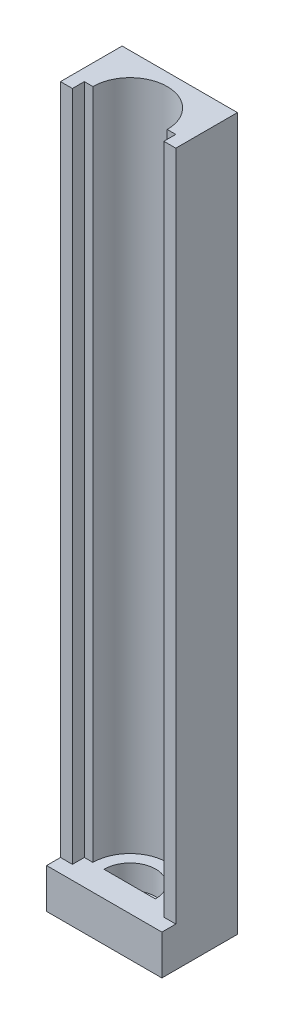
from build123d import *

# Parameters (mm, degrees)
MOLD_BLOCK_WITH_RIDGES_DEPTH  = 169
SKETCH2_W                     = 29
SKETCH2_H                     = 19
BOTTOM_LEDGE_DEPTH            = 10
ROD_ALIGNMENT_HOLE_DEPTH      = 2
ROD_ALIGNMENT_HOLE_DEPTH_BACK = 6
SUBTRACT_ACTUATOR_DEPTH       = 169


# Read off the part's stored shape, not the designer's step: subtract actuator
with BuildPart() as part:
    # Sketch1 → mold block with ridges (new body)
    with BuildSketch(Plane(origin=(0, 0, 0), x_dir=(1, 0, 0), z_dir=(0, 1, 0))):
        Polygon((3, 0), (26, 0), (26, -3), (29, -3), (29, 2.5), (29, 12.5), (0, 12.5), (0, 0), (0, -3), (3, -3), align=None)
    extrude(amount=MOLD_BLOCK_WITH_RIDGES_DEPTH)

    # Sketch2 → bottom ledge (add)
    with BuildSketch(Plane.XZ):
        with Locations((14.5, -3)):
            Rectangle(SKETCH2_W, SKETCH2_H)
    extrude(amount=BOTTOM_LEDGE_DEPTH)

    # Sketch3 → rod alignment hole (cut, two sides: drawn at the far end of the back side and taken through both)
    with BuildSketch(Plane(origin=(0, 0, 0), x_dir=(1, 0, 0), z_dir=(0, 1, 0)).offset(-ROD_ALIGNMENT_HOLE_DEPTH_BACK)):
        with BuildLine():
            Line((8.05077524, -0.1), (20.94922476, -0.1))
            ThreePointArc((20.94922476, -0.1), (14.5, 6.45), (8.05077524, -0.1))
        make_face()
    extrude(amount=ROD_ALIGNMENT_HOLE_DEPTH + ROD_ALIGNMENT_HOLE_DEPTH_BACK, mode=Mode.SUBTRACT)

    # subtract actuator outline → subtract actuator (cut)
    with BuildSketch(Plane(origin=(0, 0, 0), x_dir=(1, 0, 0), z_dir=(0, 1, 0))):
        with BuildLine():
            ThreePointArc((23.85, 0), (14.5, 9.35), (5.15, 0))
            Line((5.15, 0), (23.85, 0))
        make_face()
    extrude(amount=SUBTRACT_ACTUATOR_DEPTH, mode=Mode.SUBTRACT)


solid = part.part
